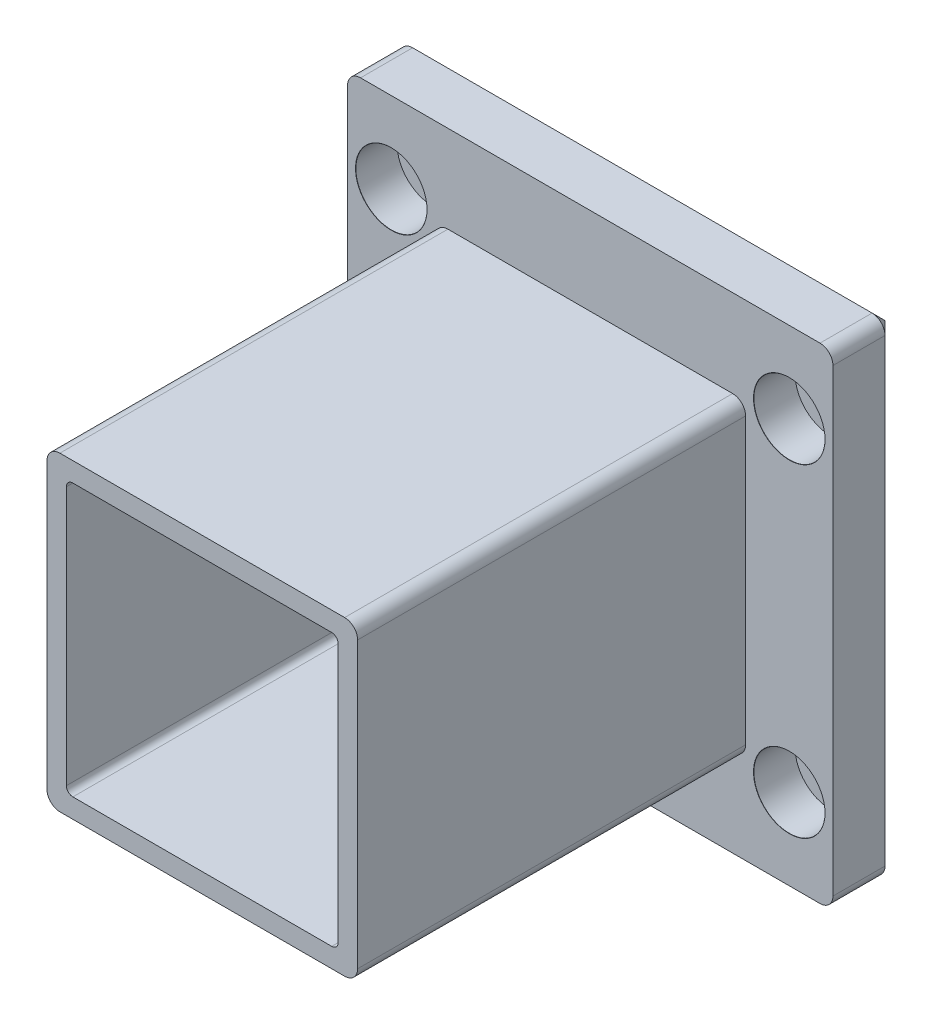
from build123d import *

# Parameters (mm, degrees)
SKETCH1_W                                    = 42
SKETCH1_H                                    = 42
BOSS_EXTRUDE1_DEPTH                          = 65
SKETCH3_W                                    = 75
SKETCH3_H                                    = 75
BOSS_EXTRUDE2_DEPTH                          = 5
SKETCH8_W                                    = 75
SKETCH8_H                                    = 75
SKETCH8_W_2                                  = 42
SKETCH8_H_2                                  = 42
BOSS_EXTRUDE3_DEPTH                          = 5.047079132
FILLET1_R                                    = 2
CBORE_FOR_M6_HEX_SOCKET_HEAD_CAP_SCR_2_COUNT = 2
CBORE_FOR_M6_HEX_SOCKET_HEAD_CAP_SCR_2_PITCH = 50
CBORE_FOR_M6_HEX_SOCKET_HEAD_CAP_SCR_3_COUNT = 2
CBORE_FOR_M6_HEX_SOCKET_HEAD_CAP_SCR_3_PITCH = 61.5
CBORE_FOR_M6_HEX_SOCKET_HEAD_CAP_SCR_4_COUNT = 2
CBORE_FOR_M6_HEX_SOCKET_HEAD_CAP_SCR_4_PITCH = 79.260645973
FILLET2_R                                    = 1
CHAMFER1_SIZE                                = 2


with BuildPart() as part:
    # Sketch1 → Boss-Extrude1 (new body)
    with BuildSketch(Plane(origin=(0, 0, 0), x_dir=(0, 1, 0), z_dir=(0, 0, 1))):
        Polygon((15.339697873, 30.146094376), (-25.048003873, 30.146094376), (-25.048003873, -17.853905624), (22.951996127, -17.853905624), (22.951996127, 30.146094376), align=None)
        with Locations((-1.048003873, 6.146094376)):
            Rectangle(SKETCH1_W, SKETCH1_H, mode=Mode.SUBTRACT)
    extrude(amount=BOSS_EXTRUDE1_DEPTH)

    # Sketch3 → Boss-Extrude2 (add)
    with BuildSketch(Plane(origin=(0, 0, 0), x_dir=(1, 0, 0), z_dir=(0, 0, -1))):
        with Locations((-6.146094376, 1.048003873)):
            Rectangle(SKETCH3_W, SKETCH3_H)
    extrude(amount=BOSS_EXTRUDE2_DEPTH)

    # Sketch8 → Boss-Extrude3 (add)
    with BuildSketch(Plane.XY):
        with Locations((-6.146094376, -1.048003873)):
            Rectangle(SKETCH8_W, SKETCH8_H)
        with Locations((-6.146094376, -1.048003873)):
            Rectangle(SKETCH8_W_2, SKETCH8_H_2, mode=Mode.SUBTRACT)
    extrude(amount=BOSS_EXTRUDE3_DEPTH)

    # Fillet1
    fillet1_edges = [part.edges().sort_by_distance(p)[0] for p in [
        (17.853905624, -25.048003873, 35.023539566),
        (17.853905624, 22.951996127, 35.023539566),
        (31.353905624, 36.451996127, 0.023539566),
        (-43.646094376, 36.451996127, 0.023539566),
        (-43.646094376, -38.548003873, 0.023539566),
        (31.353905624, -38.548003873, 0.023539566),
        (-30.146094376, 22.951996127, 35.023539566),
        (-30.146094376, -25.048003873, 35.023539566),
    ]]
    fillet(fillet1_edges, radius=FILLET1_R)

    # Sketch15 → CBORE for M6 Hex Socket Head Cap Screw2 (revolve, cut)
    with BuildSketch(Plane(origin=(-36.896094376, 23.951996127, 5.047079132), x_dir=(0, -1, 0), z_dir=(1, 0, 0))):
        Polygon((0, 0), (0, 10.047079132), (3.3, 10.047079132), (3.3, 6.4), (5.5, 6.4), (5.5, 0.025), (5.525, 0), align=None)
    cbore_for_m6_hex_socket_head_cap_screw2 = revolve(axis=Axis((-36.896094376, 23.951996127, 11.397079132), (0, 0, -1)), mode=Mode.SUBTRACT)

    # CBORE for M6 Hex Socket Head Cap Scr 2: CBORE for M6 Hex Socket Head Cap Screw2 ×2
    with Locations(*[(0, -i * CBORE_FOR_M6_HEX_SOCKET_HEAD_CAP_SCR_2_PITCH, 0) for i in range(1, CBORE_FOR_M6_HEX_SOCKET_HEAD_CAP_SCR_2_COUNT)]):
        add(cbore_for_m6_hex_socket_head_cap_screw2, mode=Mode.SUBTRACT)

    # CBORE for M6 Hex Socket Head Cap Scr 3: CBORE for M6 Hex Socket Head Cap Screw2 ×2
    with Locations(*[(i * CBORE_FOR_M6_HEX_SOCKET_HEAD_CAP_SCR_3_PITCH, 0, 0) for i in range(1, CBORE_FOR_M6_HEX_SOCKET_HEAD_CAP_SCR_3_COUNT)]):
        add(cbore_for_m6_hex_socket_head_cap_screw2, mode=Mode.SUBTRACT)

    # CBORE for M6 Hex Socket Head Cap Scr 4: CBORE for M6 Hex Socket Head Cap Screw2 ×2
    with Locations(*[Vector(0.7759210039901774, -0.63083008454486, 0) * (i * CBORE_FOR_M6_HEX_SOCKET_HEAD_CAP_SCR_4_PITCH) for i in range(1, CBORE_FOR_M6_HEX_SOCKET_HEAD_CAP_SCR_4_COUNT)]):
        add(cbore_for_m6_hex_socket_head_cap_screw2, mode=Mode.SUBTRACT)

    # Fillet2
    fillet2_edges = [part.edges().sort_by_distance(p)[0] for p in [
        (14.853905624, -22.048003873, 32.5),
        (14.853905624, 19.951996127, 32.5),
        (-27.146094376, 19.951996127, 32.5),
        (-27.146094376, -22.048003873, 32.5),
    ]]
    fillet(fillet2_edges, radius=FILLET2_R)

    # Chamfer1
    chamfer1_edges = [part.edges().sort_by_distance(p)[0] for p in [
        (-43.646094376, -1.048003873, -5),
        (-6.146094376, -38.548003873, -5),
        (-6.146094376, 36.451996127, -5),
        (-43.060307938, -37.962217436, -5),
        (-43.060307938, 35.866209689, -5),
        (30.768119187, -37.962217436, -5),
        (30.768119187, 35.866209689, -5),
        (31.353905624, -1.048003873, -5),
    ]]
    chamfer(chamfer1_edges, length=CHAMFER1_SIZE)


solid = part.part
